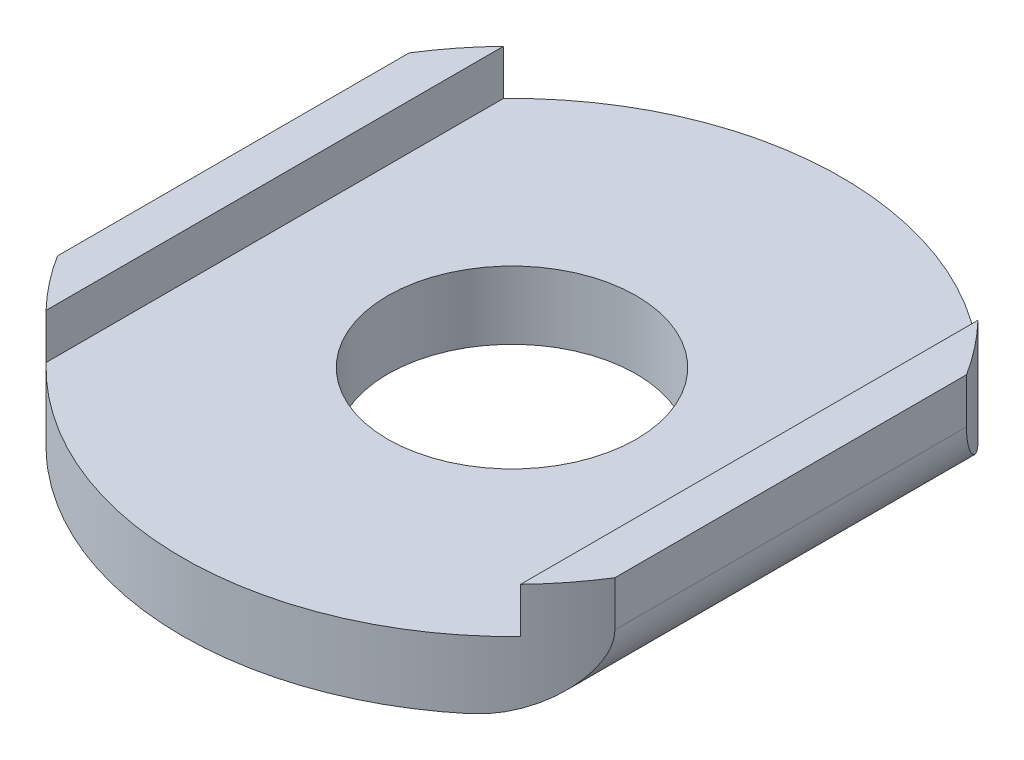
from build123d import *

# Parameters (mm, degrees)
SKETCH1_R           = 11.1125
SKETCH1_R_2         = 4.191
BASE_EXTRUDE_DEPTH  = 2.286
CUT_EXTRUDE1_DEPTH  = 16.880840925
BOSS_EXTRUDE1_DEPTH = 1.524
FILLET1_R           = 2.286


with BuildPart() as part:
    # Sketch1 → Base-Extrude (new body)
    with BuildSketch(Plane(origin=(0, 0, 0), x_dir=(-1, 0, 0), z_dir=(0, 1, 0))):
        with Locations(Location((0, 0, 0), (0, 0, 90))):
            Circle(SKETCH1_R)
        with Locations(Location((0, 0, 0), (0, 0, 90))):
            Circle(SKETCH1_R_2, mode=Mode.SUBTRACT)
    extrude(amount=BASE_EXTRUDE_DEPTH)

    # Sketch2 → Cut-Extrude1 (cut, through all)
    with BuildSketch(Plane(origin=(0, 2.286, 0), x_dir=(-1, 0, 0), z_dir=(0, 1, 0))):
        with BuildLine():
            Line((9.398, 5.930029701), (9.398, -5.930029701))
            ThreePointArc((9.398, -5.930029701), (11.1125, 0), (9.398, 5.930029701))
        make_face()
        with BuildLine():
            ThreePointArc((-9.398, 5.930029701), (-11.1125, 0), (-9.398, -5.930029701))
            Line((-9.398, -5.930029701), (-9.398, 5.930029701))
        make_face()
    extrude(amount=-CUT_EXTRUDE1_DEPTH, mode=Mode.SUBTRACT)

    # Sketch3 → Boss-Extrude1 (add)
    with BuildSketch(Plane(origin=(0, 2.286, 0), x_dir=(-1, 0, 0), z_dir=(0, 1, 0))):
        with BuildLine():
            Line((8.001, -7.711786774), (8.001, 7.711786774))
            ThreePointArc((8.001, 7.711786774), (8.744996559, 6.856580156), (9.398, 5.930029701))
            Line((9.398, 5.930029701), (9.398, -5.930029701))
            ThreePointArc((9.398, -5.930029701), (8.744996559, -6.856580156), (8.001, -7.711786774))
        make_face()
        with BuildLine():
            Line((-8.001, 7.711786774), (-8.001, -7.711786774))
            ThreePointArc((-8.001, -7.711786774), (-8.744996559, -6.856580156), (-9.398, -5.930029701))
            Line((-9.398, -5.930029701), (-9.398, 5.930029701))
            ThreePointArc((-9.398, 5.930029701), (-8.744996559, 6.856580156), (-8.001, 7.711786774))
        make_face()
    extrude(amount=BOSS_EXTRUDE1_DEPTH)

    # Fillet1
    fillet1_edges = [part.edges().sort_by_distance(p)[0] for p in [
        (9.398, 0, 0),
        (-9.398, 0, 0),
    ]]
    fillet(fillet1_edges, radius=FILLET1_R - 0.0001)  # a hair under: the kernel refuses the full size


solid = part.part
